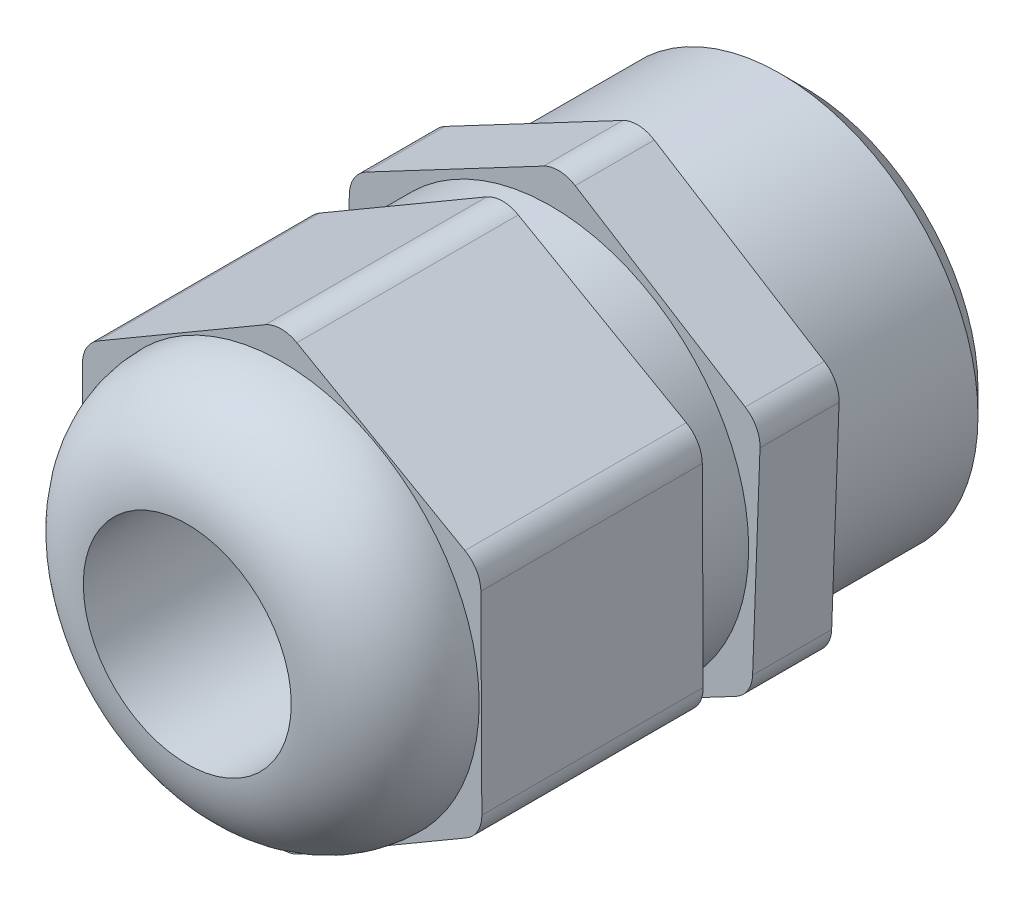
from build123d import *

# Parameters (mm, degrees)
EXTRUDE_1_DEPTH     = 5
SKETCH_3_R          = 12.5
EXTRUDE_2_DEPTH     = 11
CHAMFER_1_SIZE      = 1.5
EXTRUDE_START       = 3
SKETCH_4_R          = 12.5
EXTRUDE_3_DEPTH     = 3
EXTRUDE_4_DEPTH     = 14
SKETCH_6_R          = 12.458994032
EXTRUDE_5_DEPTH     = 6
FILLET_1_R          = 6
SKETCH_7_R          = 6.574183754
CUT_EXTRUDE_1_DEPTH = 42
FILLET_2_R          = 2


with BuildPart() as part:
    # Эскиз2 → Бобышка-Вытянуть1 (new body)
    with BuildSketch(Plane.XY):
        Polygon((12.704765165, -7.974267497), (13.258300811, 7.015515633), (0.553535647, 14.98978313), (-12.704765165, 7.974267497), (-13.258300811, -7.015515633), (-0.553535647, -14.98978313), align=None)
    extrude(amount=EXTRUDE_1_DEPTH)

    # Эскиз3 → Бобышка-Вытянуть2 (add)
    with BuildSketch(Plane(origin=(0, 0, 0), x_dir=(-1, 0, 0), z_dir=(0, 0, -1))):
        with Locations(Location((0, 0, 0), (0, 0, 180))):
            Circle(SKETCH_3_R)
    extrude(amount=EXTRUDE_2_DEPTH)

    # Фаска1
    chamfer_1_edges = [part.edges().sort_by_distance(p)[0] for p in [
        (-12.5, 0, -11),
    ]]
    chamfer(chamfer_1_edges, length=CHAMFER_1_SIZE)

    # Эскиз4 → Бобышка-Вытянуть3 (add)
    with BuildSketch(Plane.XY.offset(5).offset(EXTRUDE_START)):
        Circle(SKETCH_4_R)
    extrude(amount=-EXTRUDE_3_DEPTH)

    # Эскиз5 → Бобышка-Вытянуть4 (add)
    with BuildSketch(Plane.XY.offset(8)):
        Polygon((12.559385181, 7.335539252), (-0.073070753, 14.544516248), (-12.632455933, 7.208976996), (-12.559385181, -7.335539252), (0.073070753, -14.544516248), (12.632455933, -7.208976996), align=None)
    extrude(amount=EXTRUDE_4_DEPTH)

    # Эскиз6 → Бобышка-Вытянуть5 (add)
    with BuildSketch(Plane.XY.offset(22)):
        Circle(SKETCH_6_R)
    extrude(amount=EXTRUDE_5_DEPTH)

    # Скругление1
    fillet_1_edges = [part.edges().sort_by_distance(p)[0] for p in [
        (-12.458994032, 0, 28),
    ]]
    fillet(fillet_1_edges, radius=FILLET_1_R - 0.0001)  # a hair under: the kernel refuses the full size

    # Эскиз7 → Вырез-Вытянуть1 (cut)
    with BuildSketch(Plane.XY.offset(28)):
        with Locations(Location((0, 0, 0), (0, 0, 180))):
            Circle(SKETCH_7_R)
    extrude(amount=-CUT_EXTRUDE_1_DEPTH, mode=Mode.SUBTRACT)

    # Скругление2
    fillet_2_edges = [part.edges().sort_by_distance(p)[0] for p in [
        (-0.553535647, -14.98978313, 2.5),
        (-13.258300811, -7.015515633, 2.5),
        (-12.704765165, 7.974267497, 2.5),
        (0.553535647, 14.98978313, 2.5),
        (13.258300811, 7.015515633, 2.5),
        (12.704765165, -7.974267497, 2.5),
        (12.632455933, -7.208976996, 15),
        (12.559385181, 7.335539252, 15),
        (-0.073070753, 14.544516248, 15),
        (-12.632455933, 7.208976996, 15),
        (-12.559385181, -7.335539252, 15),
        (0.073070753, -14.544516248, 15),
    ]]
    fillet(fillet_2_edges, radius=FILLET_2_R)


solid = part.part
